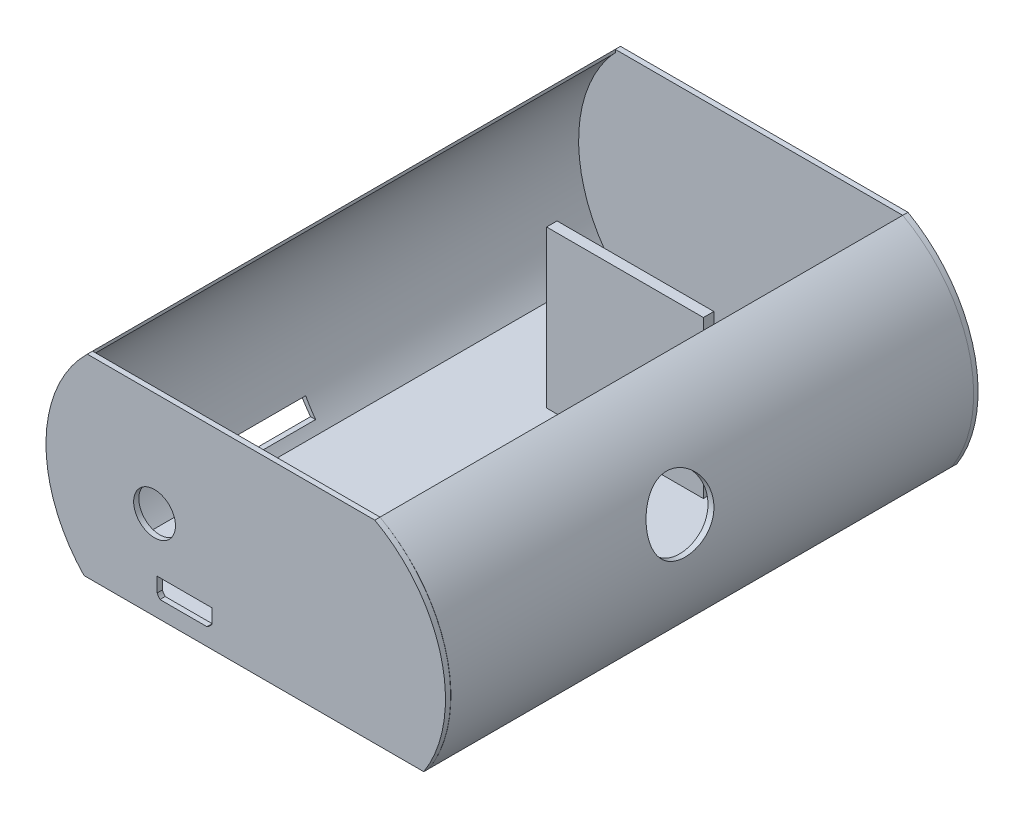
from build123d import *

# Parameters (mm, degrees)
BOSS_EXTRUDE6_DEPTH      = 100
BOSS_EXTRUDE6_DEPTH_BACK = 0.001
SKETCH19_R               = 6.25
SIDE_BUTTON_DEPTH        = 10
SKETCH21_W               = 13
SKETCH21_H               = 3
SD_DEPTH                 = 10
SKETCH_5_W               = 55
SKETCH_5_H               = 100.001
CUT_EXTRUDE_4_DEPTH      = 7
SKETCH_4_R               = 4
PORTS_DEPTH              = 1
TOP_COVER_DEPTH          = 1
SKETCH_7_W               = 30
SKETCH_7_H               = 2
EXTRUDE_5_DEPTH          = 30


with BuildPart() as part:
    # Sketch11 → Boss-Extrude6 (new, two sides: drawn at the far end of the back side and taken through both)
    with BuildSketch(Plane.XY.offset(-BOSS_EXTRUDE6_DEPTH_BACK)):
        with BuildLine():
            Line((4.074232727, 31.436762529), (-50.925767273, 31.436762529))
            ThreePointArc((-50.925767273, 31.436762529), (-58.976171577, 13.069519435), (-51.560984569, -5.563237471))
            Line((-51.560984569, -5.563237471), (13.439015431, -5.563237471))
            ThreePointArc((13.439015431, -5.563237471), (16.843059589, 14.983457432), (4.074232727, 31.436762529))
        make_face()
        with BuildLine():
            ThreePointArc((-51.560984569, -4.564491122), (-57.931377732, 13.23837012), (-51.012961367, 30.835508878))
            Line((-51.012961367, 30.835508878), (3.987038633, 30.835508878))
            ThreePointArc((3.987038633, 30.835508878), (15.684365135, 14.996890968), (13.439015431, -4.564491122))
            Line((13.439015431, -4.564491122), (-51.560984569, -4.564491122))
        make_face(mode=Mode.SUBTRACT)
    extrude(amount=BOSS_EXTRUDE6_DEPTH + BOSS_EXTRUDE6_DEPTH_BACK)

    # Sketch19 → side button (cut)
    with BuildSketch(Plane(origin=(17.637860169, 0, 0), x_dir=(0, 0, -1), z_dir=(1, 0, 0))):
        with Locations((-55.2, 15.436762529)):
            Circle(SKETCH19_R)
    extrude(amount=-SIDE_BUTTON_DEPTH, mode=Mode.SUBTRACT)

    # Sketch21 → sd (cut)
    with BuildSketch(Plane.ZY.offset(58.980002369)):
        with Locations((62, -1.563237471)):
            Rectangle(SKETCH21_W, SKETCH21_H)
    extrude(amount=-SD_DEPTH, mode=Mode.SUBTRACT)

    # 草图5 → 切除-拉伸4 (cut)
    with BuildSketch(Plane(origin=(0, 31.436762529, 0), x_dir=(1, 0, 0), z_dir=(0, 1, 0))):
        with Locations((-23.425767273, -49.9995)):
            Rectangle(SKETCH_5_W, SKETCH_5_H)
    extrude(amount=-CUT_EXTRUDE_4_DEPTH, mode=Mode.SUBTRACT)

    # 草图4 → ports (add)
    with BuildSketch(Plane.XY.offset(100)):
        with BuildLine():
            Line((-50.925767273, 31.436762529), (4.074232727, 31.436762529))
            ThreePointArc((4.074232727, 31.436762529), (16.797971673, 14.972045579), (13.439015431, -5.563237471))
            Line((13.439015431, -5.563237471), (-51.560984569, -5.563237471))
            ThreePointArc((-51.560984569, -5.563237471), (-58.825710556, 13.066936315), (-50.925767273, 31.436762529))
        make_face()
        with Locations((-38.060984569, 11.436762529)):
            Circle(SKETCH_4_R, mode=Mode.SUBTRACT)
        with BuildLine():
            Line((-37.560984569, 1.332835104), (-27.101744103, 1.332835104))
            Line((-27.101744103, 1.332835104), (-27.101744103, -1.446793765))
            ThreePointArc((-27.101744103, -1.446793765), (-27.522930097, -1.907180738), (-28.029632197, -2.271332887))
            Line((-28.029632197, -2.271332887), (-37.028696773, -2.271332887))
            ThreePointArc((-37.028696773, -2.271332887), (-37.327749623, -1.880307962), (-37.560984569, -1.446793765))
            Line((-37.560984569, -1.446793765), (-37.560984569, 1.332835104))
        make_face(mode=Mode.SUBTRACT)
    extrude(amount=PORTS_DEPTH)

    # 草图6 → top cover (add)
    with BuildSketch(Plane(origin=(0, 0, -0.001), x_dir=(-1, 0, 0), z_dir=(0, 0, -1))):
        with BuildLine():
            Line((-4.074232727, 31.436762529), (50.925767273, 31.436762529))
            ThreePointArc((50.925767273, 31.436762529), (58.934474425, 13.068803577), (51.560984569, -5.563237471))
            Line((51.560984569, -5.563237471), (-13.439015431, -5.563237471))
            ThreePointArc((-13.439015431, -5.563237471), (-16.680513275, 14.942316596), (-4.074232727, 31.436762529))
        make_face()
    extrude(amount=TOP_COVER_DEPTH)

    # 草图7 → 凸台-拉伸5 (add)
    with BuildSketch(Plane(origin=(0, -4.564491122, 0), x_dir=(1, 0, 0), z_dir=(0, 1, 0))):
        with Locations((-19.060984569, -29)):
            Rectangle(SKETCH_7_W, SKETCH_7_H)
    extrude(amount=EXTRUDE_5_DEPTH)


solid = part.part
